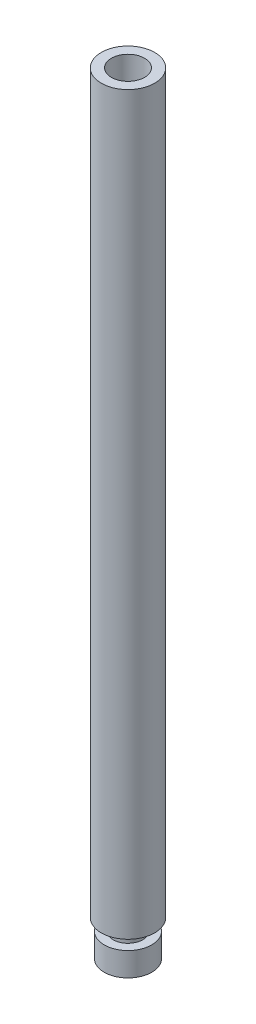
from build123d import *

# Parameters (mm, degrees)
SKETCH1_R           = 2.25
BOSS_EXTRUDE1_DEPTH = 62
SKETCH1_3_R         = 1.375
BOSS_EXTRUDE2_DEPTH = 1
SKETCH5_R           = 1.25
BOSS_EXTRUDE3_DEPTH = 1
SKETCH6_R           = 2
BOSS_EXTRUDE4_DEPTH = 2
SKETCH12_R          = 1.4
CUT_EXTRUDE1_DEPTH  = 15


with BuildPart() as part:
    # Sketch1 → Boss-Extrude1 (new body)
    with BuildSketch(Plane(origin=(0, 0, 0), x_dir=(1, 0, 0), z_dir=(0, 1, 0))):
        with Locations((-0.522013312, 0.511138034)):
            Circle(SKETCH1_R)
    extrude(amount=BOSS_EXTRUDE1_DEPTH)

    # Sketch1<3> → Boss-Extrude2 (add)
    with BuildSketch(Plane(origin=(0, 0, 0), x_dir=(1, 0, 0), z_dir=(0, 1, 0))):
        with Locations((-0.522013312, 0.511138034)):
            Circle(SKETCH1_3_R)
    extrude(amount=BOSS_EXTRUDE2_DEPTH)

    # Sketch5 → Boss-Extrude3 (add)
    with BuildSketch(Plane.XZ):
        with Locations((-0.522013312, -0.511138034)):
            Circle(SKETCH5_R)
    extrude(amount=BOSS_EXTRUDE3_DEPTH)

    # Sketch6 → Boss-Extrude4 (add)
    with BuildSketch(Plane.XZ.offset(1)):
        with Locations((-0.522013312, -0.511138034)):
            Circle(SKETCH6_R)
    extrude(amount=BOSS_EXTRUDE4_DEPTH)

    # Sketch12 → Cut-Extrude1 (cut)
    with BuildSketch(Plane(origin=(0, 62, 0), x_dir=(1, 0, 0), z_dir=(0, 1, 0))):
        with Locations((-0.522013312, 0.511138034)):
            Circle(SKETCH12_R)
    extrude(amount=-CUT_EXTRUDE1_DEPTH, mode=Mode.SUBTRACT)


solid = part.part
